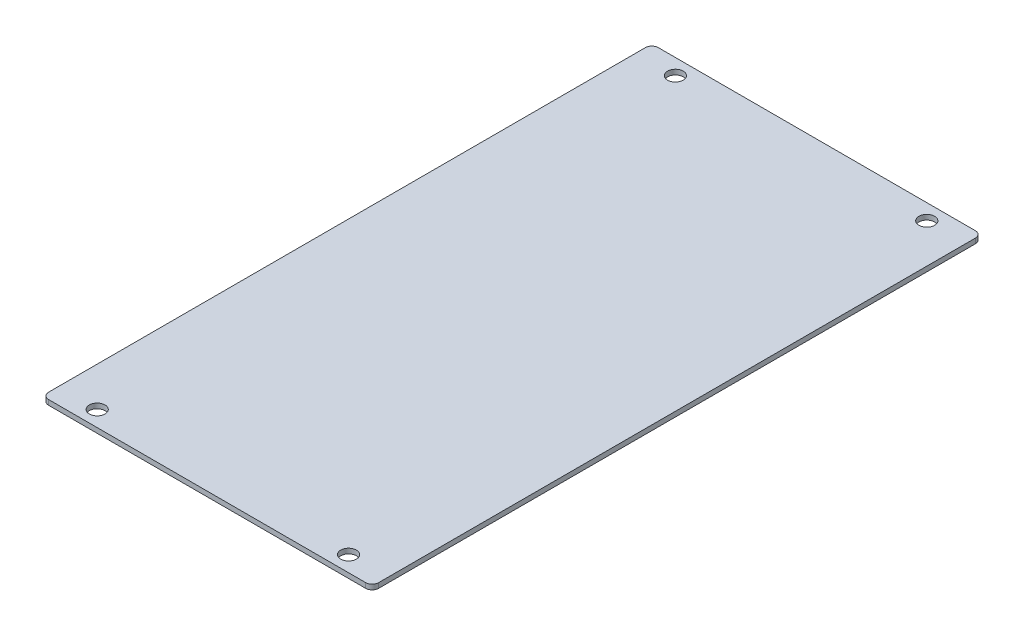
from build123d import *

# Parameters (mm, degrees)
SKETCH1_W          = 210
SKETCH1_H          = 388
BASE_FLANGE1_DEPTH = 3.175
FILLET1_R          = 4.1
SKETCH6_R          = 5
CUT_EXTRUDE1_DEPTH = 10


# Sheet-metal steps are written as plain solids
with BuildPart() as part:
    # Sketch1 → Base-Flange1 (new body)
    with BuildSketch(Plane(origin=(0, 0, 0), x_dir=(1, 0, 0), z_dir=(0, 1, 0))):
        with Locations((105, 194)):
            Rectangle(SKETCH1_W, SKETCH1_H)
    extrude(amount=-BASE_FLANGE1_DEPTH)

    # Fillet1
    fillet1_edges = [part.edges().sort_by_distance(p)[0] for p in [
        (0, -1.5875, -388),
        (210, -1.5875, -388),
        (210, -1.5875, 0),
        (0, -1.5875, 0),
    ]]
    fillet(fillet1_edges, radius=FILLET1_R)

    # Sketch6 → Cut-Extrude1 (cut)
    with BuildSketch(Plane(origin=(0, 0, 0), x_dir=(1, 0, 0), z_dir=(0, 1, 0))):
        with Locations(Location((25, 378, 0), (0, 0, 270))):
            Circle(SKETCH6_R)
        with Locations(Location((185, 378, 0), (0, 0, 270))):
            Circle(SKETCH6_R)
        with Locations(Location((185, 10, 0), (0, 0, 270))):
            Circle(SKETCH6_R)
        with Locations(Location((25, 10, 0), (0, 0, 270))):
            Circle(SKETCH6_R)
    extrude(amount=-CUT_EXTRUDE1_DEPTH, mode=Mode.SUBTRACT)


solid = part.part
